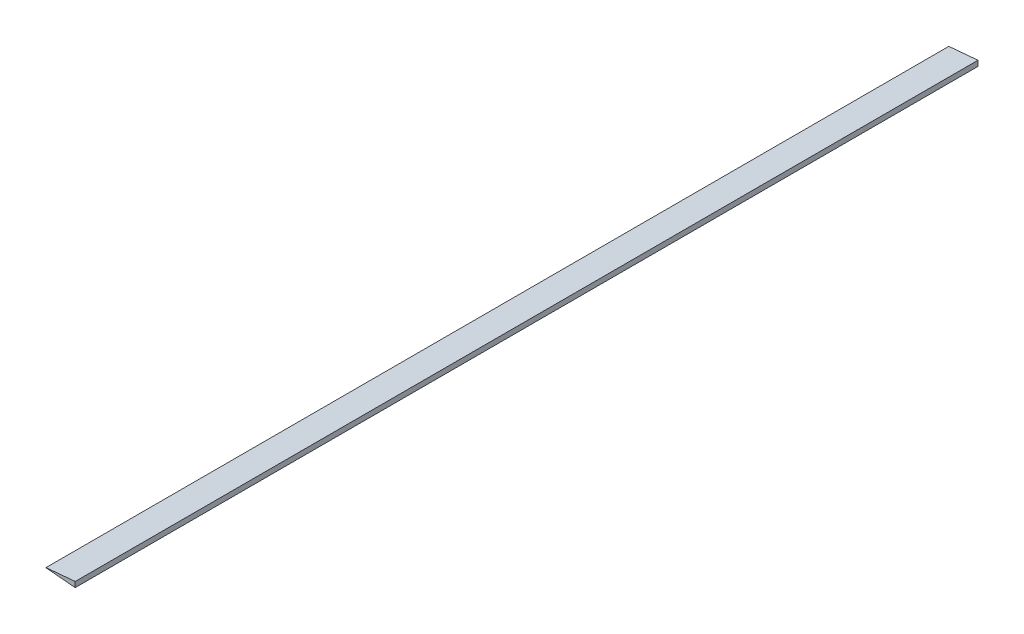
from build123d import *

# Parameters (mm, degrees)
BOSS_EXTRUDE1_DEPTH = 422.9


with BuildPart() as part:
    # Sketch1 → Boss-Extrude1 (new, symmetric)
    with BuildSketch(Plane.XY):
        with BuildLine():
            Line((-63.8442, 2.505531594), (-63.8442, -2.505531594))
            add(Edge.make_bspline(
                [(-63.8442, -2.505531594), (-63.946604848, -2.498305855), (-65.467237861, -2.39100921), (-68.321854997, -2.169939406), (-72.310568212, -1.851492991), (-76.006515494, -1.538810931), (-79.369390831, -1.241571556), (-82.362301131, -0.965965408), (-84.952466427, -0.718776556), (-87.111509959, -0.506271108), (-88.815786168, -0.334209025), (-90.046629734, -0.207466097), (-90.790570087, -0.129860318), (-91.122727913, -0.094943363), (-91.206, -0.08618967)],
                knots=[0, 0, 0, 0, 0.011211572, 0.166483201, 0.31268616, 0.448210553, 0.571562716, 0.681381362, 0.776452467, 0.855722863, 0.918312437, 0.963524724, 0.990855635, 1, 1, 1, 1], degree=3))
            Line((-91.206, -0.08618967), (-91.206, 0.08618967))
            add(Edge.make_bspline(
                [(-63.8442, 2.505531594), (-63.946604848, 2.498305855), (-65.467237861, 2.39100921), (-68.321854997, 2.169939406), (-72.310568212, 1.851492991), (-76.006515494, 1.538810931), (-79.369390831, 1.241571556), (-82.362301131, 0.965965408), (-84.952466427, 0.718776556), (-87.111509959, 0.506271108), (-88.815786168, 0.334209025), (-90.046629734, 0.207466097), (-90.790570087, 0.129860318), (-91.122727913, 0.094943363), (-91.206, 0.08618967)],
                knots=[0, 0, 0, 0, 0.011211572, 0.166483201, 0.31268616, 0.448210553, 0.571562716, 0.681381362, 0.776452467, 0.855722863, 0.918312437, 0.963524724, 0.990855635, 1, 1, 1, 1], degree=3))
        make_face()
    extrude(amount=BOSS_EXTRUDE1_DEPTH, both=True)


solid = part.part
